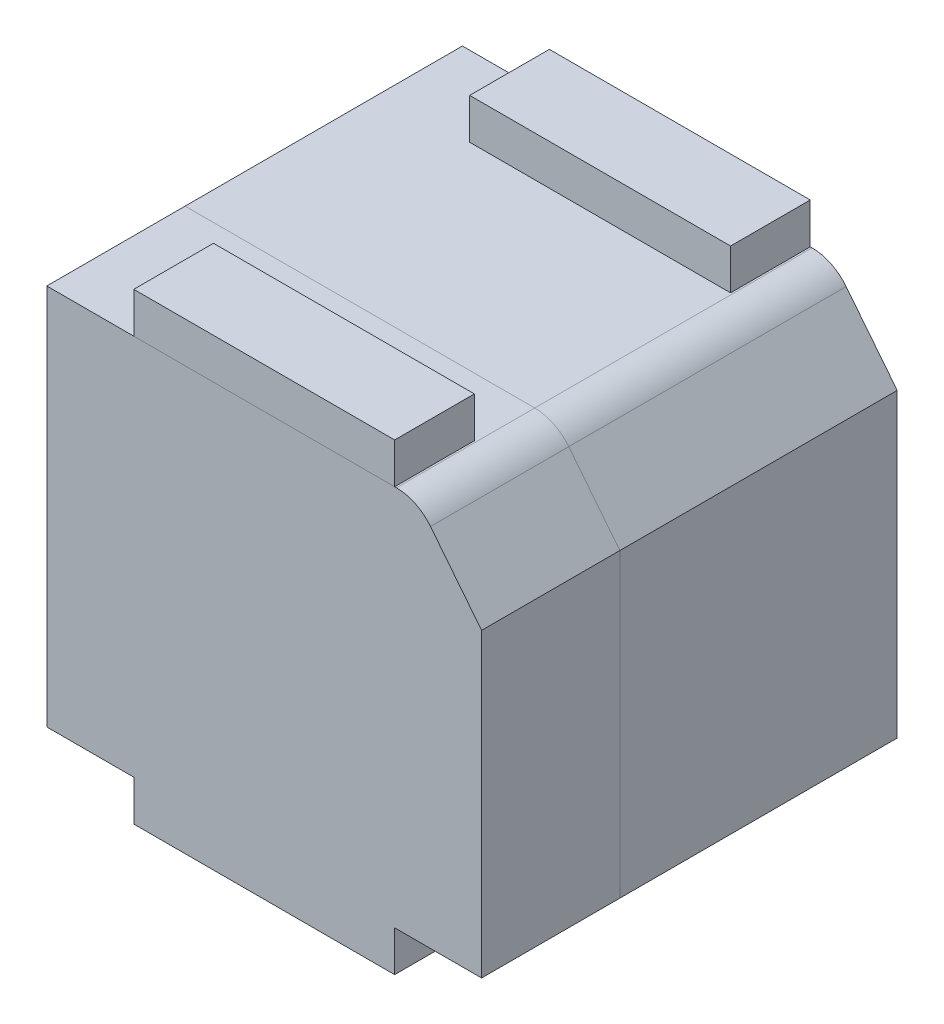
from build123d import *

# Parameters (mm, degrees)
BOSS_EXTRUDE1_DEPTH = 286.76549888
SKETCH4_W           = 180
SKETCH4_H           = 55
BOSS_EXTRUDE2_DEPTH = 28
SKETCH5_W           = 180
SKETCH5_H           = 55
BOSS_EXTRUDE3_DEPTH = 28
CAVITY1_OUTLINE_W   = 91.186
CAVITY1_OUTLINE_H   = 1.784836657
CAVITY1_OUTLINE_W_2 = 8.026725253
CAVITY1_OUTLINE_H_2 = 98.533188028
CAVITY1_OUTLINE_H_3 = 113.099701296
CAVITY1_OUTLINE_W_3 = 27.089727247
CAVITY1_OUTLINE_H_4 = 10.562936239
CAVITY1_OUTLINE_H_5 = 30
CAVITY1_OUTLINE_W_4 = 0.3800475
CAVITY1_OUTLINE_W_5 = 11.74498794


# Read off the part's stored shape, not the designer's step: Cavity1
with BuildPart() as part:
    # Sketch1 → Boss-Extrude1 (new body)
    with BuildSketch(Plane.XY):
        with BuildLine():
            Line((71.6, 263.525), (241.253264435, 263.525))
            ThreePointArc((241.253264435, 263.525), (254.305941556, 260.536620091), (264.758194807, 252.16684133))
            Line((264.758194807, 252.16684133), (300, 207.731521739))
            Line((300, 207.731521739), (300, 0))
            Line((300, 0), (0, 0))
            Line((0, 0), (0, 263.525))
            Line((0, 263.525), (71.6, 263.525))
        make_face()
    extrude(amount=BOSS_EXTRUDE1_DEPTH)

    # Sketch4 → Boss-Extrude2 (add)
    with BuildSketch(Plane(origin=(0, 263.525, 0), x_dir=(1, 0, 0), z_dir=(0, 1, 0))):
        with Locations((150, -27.5)):
            Rectangle(SKETCH4_W, SKETCH4_H)
        with Locations((150, -259.26549888)):
            Rectangle(SKETCH4_W, SKETCH4_H)
    extrude(amount=BOSS_EXTRUDE2_DEPTH)

    # Sketch5 → Boss-Extrude3 (add)
    with BuildSketch(Plane.XZ):
        Polygon((150, 286.76549888), (60, 286.76549888), (60, 231.76549888), (240, 231.76549888), (240, 286.76549888), align=None)
        with Locations((150, 27.5)):
            Rectangle(SKETCH5_W, SKETCH5_H)
    extrude(amount=BOSS_EXTRUDE3_DEPTH)

    # Cavity1 outline → Cavity1 (revolve, cut)
    with BuildSketch(Plane(origin=(150, 131.7625, 0), x_dir=(1, 0, 0), z_dir=(0, -1, 0))):
        with BuildLine():
            Line((91.186, 185.232310852), (91.186, 183.447474195))
            add(Edge.make_bspline(
                [(91.186, 183.447474195), (93.993075649, 183.447474195), (96.709658085, 184.061599328), (99.212725253, 185.232310852)],
                knots=[0, 0, 0, 0, 1, 1, 1, 1], degree=3, weights=[0.254333095, 0.254333095, 0.258499794, 0.266833191]))
            Line((99.212725253, 185.232310852), (91.186, 185.232310852))
        make_face()
        with Locations((45.593, 184.339892523)):
            Rectangle(CAVITY1_OUTLINE_W, CAVITY1_OUTLINE_H)
        with BuildLine():
            Line((99.212725253, 283.76549888), (99.212725253, 185.232310852))
            Line((99.212725253, 185.232310852), (112.298492351, 191.352665326))
            ThreePointArc((112.298492351, 191.352665326), (117.916780417, 195.423410631), (121.629866106, 201.2842231))
            ThreePointArc((121.629866106, 201.2842231), (124.621892953, 210.722855527), (126.3024525, 220.480710125))
            Line((126.3024525, 220.480710125), (126.3024525, 283.76549888))
            Line((126.3024525, 283.76549888), (99.212725253, 283.76549888))
        make_face()
        with Locations((95.199362627, 234.498904866)):
            Rectangle(CAVITY1_OUTLINE_W_2, CAVITY1_OUTLINE_H_2)
        with Locations((45.593, 157.555055867)):
            Rectangle(CAVITY1_OUTLINE_W, CAVITY1_OUTLINE_H)
        with BuildLine():
            add(Edge.make_bspline(
                [(91.186, 158.447474195), (93.993075649, 158.447474195), (96.709658085, 157.833349062), (99.212725252, 156.662637538)],
                knots=[0, 0, 0, 0, 1, 1, 1, 1], degree=3, weights=[0.254333095, 0.254333095, 0.258499794, 0.266833191]))
            Line((91.186, 158.447474195), (91.186, 156.662637538))
            Line((91.186, 156.662637538), (99.212725252, 156.662637538))
        make_face()
        with Locations((45.593, 234.498904866)):
            Rectangle(CAVITY1_OUTLINE_W, CAVITY1_OUTLINE_H_2)
        with BuildLine():
            Line((118.28032234, 147.744516631), (99.212725253, 156.662637538))
            Line((99.212725253, 156.662637538), (99.212725253, 43.562936242))
            Line((99.212725253, 43.562936242), (126.3024525, 43.562936242))
            Line((126.3024525, 43.562936242), (126.3024525, 57.690182996))
            ThreePointArc((126.3024525, 57.690182996), (126.294837258, 58.562803318), (126.271993851, 59.435157831))
            Line((126.271993851, 59.435157831), (123.461882132, 139.906228772))
            ThreePointArc((123.461882132, 139.906228772), (121.975196847, 144.555242839), (118.28032234, 147.744516631))
        make_face()
        with Locations((95.199362627, 100.11278689)):
            Rectangle(CAVITY1_OUTLINE_W_2, CAVITY1_OUTLINE_H_3)
        with Locations((45.593, 100.11278689)):
            Rectangle(CAVITY1_OUTLINE_W, CAVITY1_OUTLINE_H_3)
        with BuildLine():
            Line((126.3024525, 283.76549888), (126.3024525, 220.480710125))
            ThreePointArc((126.3024525, 220.480710125), (126.587425903, 224.186144178), (126.6825, 227.901303969))
            Line((126.6825, 227.901303969), (126.6825, 242.901303969))
            Line((126.6825, 242.901303969), (126.6825, 283.76549888))
            Line((126.6825, 283.76549888), (126.3024525, 283.76549888))
        make_face()
        with Locations((112.757588876, 38.281468123)):
            Rectangle(CAVITY1_OUTLINE_W_3, CAVITY1_OUTLINE_H_4)
        with Locations((95.199362627, 38.281468123)):
            Rectangle(CAVITY1_OUTLINE_W_2, CAVITY1_OUTLINE_H_4)
        with Locations((45.593, 38.281468123)):
            Rectangle(CAVITY1_OUTLINE_W, CAVITY1_OUTLINE_H_4)
        with BuildLine():
            Line((138.42748794, 283.76549888), (126.6825, 283.76549888))
            Line((126.6825, 283.76549888), (126.6825, 242.901303969))
            ThreePointArc((126.6825, 242.901303969), (128.772790503, 247.610590009), (133.6675, 249.219474195))
            ThreePointArc((133.6675, 249.219474195), (136.674112341, 250.009893069), (138.42748794, 252.57702255))
            Line((138.42748794, 252.57702255), (138.42748794, 283.76549888))
        make_face()
        with Locations((112.757588876, 18.000000003)):
            Rectangle(CAVITY1_OUTLINE_W_3, CAVITY1_OUTLINE_H_5)
        with Locations((95.199362627, 18.000000003)):
            Rectangle(CAVITY1_OUTLINE_W_2, CAVITY1_OUTLINE_H_5)
        with BuildLine():
            add(Edge.make_bspline(
                [(126.6825, 41.395952164), (126.418277303, 42.125925369), (126.3024525, 42.859503255), (126.3024525, 43.562936242)],
                knots=[0.72047601, 0.72047601, 0.72047601, 0.72047601, 1, 1, 1, 1], degree=3, weights=[0.379245784, 0.4147972, 0.457937335, 0.50866619]))
            Line((126.3024525, 43.562936242), (126.3024525, 33.000000003))
            Line((126.3024525, 33.000000003), (126.6825, 33.000000003))
            Line((126.6825, 33.000000003), (126.6825, 41.395952164))
        make_face()
        with Locations((45.593, 18.000000003)):
            Rectangle(CAVITY1_OUTLINE_W, CAVITY1_OUTLINE_H_5)
        with BuildLine():
            Line((138.42748794, 283.76549888), (138.42748794, 252.57702255))
            ThreePointArc((138.42748794, 252.57702255), (138.5166365, 253.044529316), (138.555289406, 253.518887825))
            Line((138.555289406, 253.518887825), (138.555289406, 253.76549888))
            Line((138.555289406, 253.76549888), (138.555289406, 283.76549888))
            Line((138.555289406, 283.76549888), (138.42748794, 283.76549888))
        make_face()
        with Locations((126.49247625, 18.000000003)):
            Rectangle(CAVITY1_OUTLINE_W_4, CAVITY1_OUTLINE_H_5)
        with BuildLine():
            add(Edge.make_bspline(
                [(133.5197355, 37.275474195), (130.193166053, 36.803706911), (127.664699974, 38.682409113), (126.6825, 41.395952164)],
                knots=[0, 0, 0, 0, 0.72047601, 0.72047601, 0.72047601, 0.72047601], degree=3, weights=[0.255591692, 0.246393608, 0.287611638, 0.379245784]))
            Line((126.6825, 41.395952164), (126.6825, 33.000000003))
            Line((126.6825, 33.000000003), (138.42748794, 33.000000003))
            add(Edge.make_bspline(
                [(133.5197355, 37.275474195), (136.705561076, 37.727281471), (138.42748794, 35.395121996), (138.42748794, 33.000000003)],
                knots=[0, 0, 0, 0, 1, 1, 1, 1], degree=3, weights=[0.255591692, 0.242825015, 0.327183181, 0.50866619]))
        make_face()
        with BuildLine():
            Line((138.555289406, 253.76549888), (138.555289406, 253.518887825))
            ThreePointArc((138.555289406, 253.518887825), (138.556572331, 253.580534656), (138.557, 253.642193352))
            ThreePointArc((138.557, 253.642193352), (138.556572331, 253.703852049), (138.555289406, 253.76549888))
        make_face()
        with Locations((132.55499397, 18.000000003)):
            Rectangle(CAVITY1_OUTLINE_W_5, CAVITY1_OUTLINE_H_5)
    revolve(axis=Axis((150, 131.7625, 0), (0, 0, 1)), mode=Mode.SUBTRACT)


with BuildPart() as body_2:
    # Split1: the piece on the far side of the plane
    add(part.part)
    split(bisect_by=Plane.ZX.offset(263.525), keep=Keep.BOTTOM)


with BuildPart() as part_1:
    add(part.part)

    # Split1
    split(bisect_by=Plane.ZX.offset(263.525), keep=Keep.TOP)


with BuildPart() as body_3:
    # Split2: the piece on the far side of the plane
    add(body_2.part)
    split(bisect_by=Plane(origin=(0, 0, 191.352665326), x_dir=(0, -1, 0), z_dir=(0, 0, -1)), keep=Keep.BOTTOM)


with BuildPart() as body_2_1:
    add(body_2.part)

    # Split2
    split(bisect_by=Plane(origin=(0, 0, 191.352665326), x_dir=(0, -1, 0), z_dir=(0, 0, -1)), keep=Keep.TOP)


solid = Compound([part_1.part, body_3.part, body_2_1.part])
